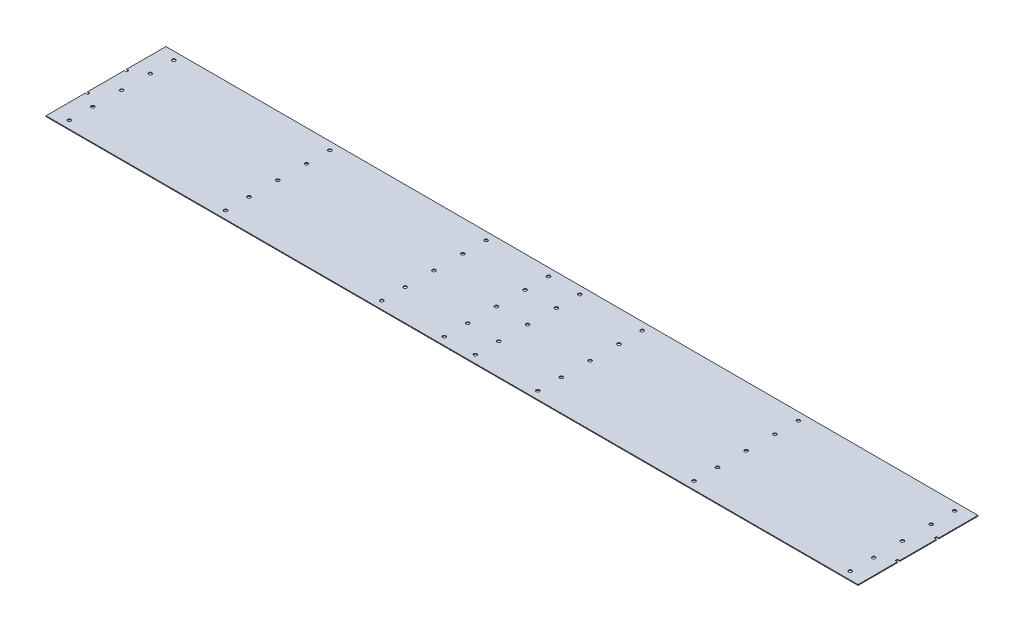
from build123d import *

# Parameters (mm, degrees)
SKETCH1_R           = 2.15
BOSS_EXTRUDE1_DEPTH = 1


with BuildPart() as part:
    # Sketch1 → Boss-Extrude1 (new body)
    with BuildSketch(Plane(origin=(0, 0, 0), x_dir=(1, 0, 0), z_dir=(0, 1, 0))):
        Polygon((-17, -26.5), (-20, -26.5), (-20, -76.8), (1020, -76.8), (1020, -26.5), (1017, -26.5), (1017, -23.5), (1020, -23.5), (1020, 23.5), (1017, 23.5), (1017, 26.5), (1020, 26.5), (1020, 76.8), (-20, 76.8), (-20, 26.5), (-17, 26.5), (-17, 23.5), (-20, 23.5), (-20, -23.5), (-17, -23.5), align=None)
        with Locations((0, -66.8)):
            Circle(SKETCH1_R, mode=Mode.SUBTRACT)
        with Locations((200, -66.8)):
            Circle(SKETCH1_R, mode=Mode.SUBTRACT)
        with Locations((400, -66.8)):
            Circle(SKETCH1_R, mode=Mode.SUBTRACT)
        with Locations((480, -66.8)):
            Circle(SKETCH1_R, mode=Mode.SUBTRACT)
        with Locations((0, -36.8)):
            Circle(SKETCH1_R, mode=Mode.SUBTRACT)
        with Locations((200, -36.8)):
            Circle(SKETCH1_R, mode=Mode.SUBTRACT)
        Circle(SKETCH1_R, mode=Mode.SUBTRACT)
        with Locations((200, 0)):
            Circle(SKETCH1_R, mode=Mode.SUBTRACT)
        with Locations((400, -36.8)):
            Circle(SKETCH1_R, mode=Mode.SUBTRACT)
        with Locations((480, -36.8)):
            Circle(SKETCH1_R, mode=Mode.SUBTRACT)
        with Locations((400, 0)):
            Circle(SKETCH1_R, mode=Mode.SUBTRACT)
        with Locations((480, 0)):
            Circle(SKETCH1_R, mode=Mode.SUBTRACT)
        with Locations((520, -66.8)):
            Circle(SKETCH1_R, mode=Mode.SUBTRACT)
        with Locations((600, -66.8)):
            Circle(SKETCH1_R, mode=Mode.SUBTRACT)
        with Locations((800, -66.8)):
            Circle(SKETCH1_R, mode=Mode.SUBTRACT)
        with Locations((1000, -66.8)):
            Circle(SKETCH1_R, mode=Mode.SUBTRACT)
        with Locations((520, -36.8)):
            Circle(SKETCH1_R, mode=Mode.SUBTRACT)
        with Locations((600, -36.8)):
            Circle(SKETCH1_R, mode=Mode.SUBTRACT)
        with Locations((520, 0)):
            Circle(SKETCH1_R, mode=Mode.SUBTRACT)
        with Locations((600, 0)):
            Circle(SKETCH1_R, mode=Mode.SUBTRACT)
        with Locations((800, -36.8)):
            Circle(SKETCH1_R, mode=Mode.SUBTRACT)
        with Locations((1000, -36.8)):
            Circle(SKETCH1_R, mode=Mode.SUBTRACT)
        with Locations((800, 0)):
            Circle(SKETCH1_R, mode=Mode.SUBTRACT)
        with Locations((1000, 0)):
            Circle(SKETCH1_R, mode=Mode.SUBTRACT)
        with Locations((0, 36.8)):
            Circle(SKETCH1_R, mode=Mode.SUBTRACT)
        with Locations((200, 36.8)):
            Circle(SKETCH1_R, mode=Mode.SUBTRACT)
        with Locations((400, 36.8)):
            Circle(SKETCH1_R, mode=Mode.SUBTRACT)
        with Locations((480, 36.8)):
            Circle(SKETCH1_R, mode=Mode.SUBTRACT)
        with Locations((0, 66.8)):
            Circle(SKETCH1_R, mode=Mode.SUBTRACT)
        with Locations((200, 66.8)):
            Circle(SKETCH1_R, mode=Mode.SUBTRACT)
        with Locations((400, 66.8)):
            Circle(SKETCH1_R, mode=Mode.SUBTRACT)
        with Locations((480, 66.8)):
            Circle(SKETCH1_R, mode=Mode.SUBTRACT)
        with Locations((520, 36.8)):
            Circle(SKETCH1_R, mode=Mode.SUBTRACT)
        with Locations((600, 36.8)):
            Circle(SKETCH1_R, mode=Mode.SUBTRACT)
        with Locations((800, 36.8)):
            Circle(SKETCH1_R, mode=Mode.SUBTRACT)
        with Locations((1000, 36.8)):
            Circle(SKETCH1_R, mode=Mode.SUBTRACT)
        with Locations((520, 66.8)):
            Circle(SKETCH1_R, mode=Mode.SUBTRACT)
        with Locations((600, 66.8)):
            Circle(SKETCH1_R, mode=Mode.SUBTRACT)
        with Locations((800, 66.8)):
            Circle(SKETCH1_R, mode=Mode.SUBTRACT)
        with Locations((1000, 66.8)):
            Circle(SKETCH1_R, mode=Mode.SUBTRACT)
    extrude(amount=BOSS_EXTRUDE1_DEPTH)


solid = part.part
